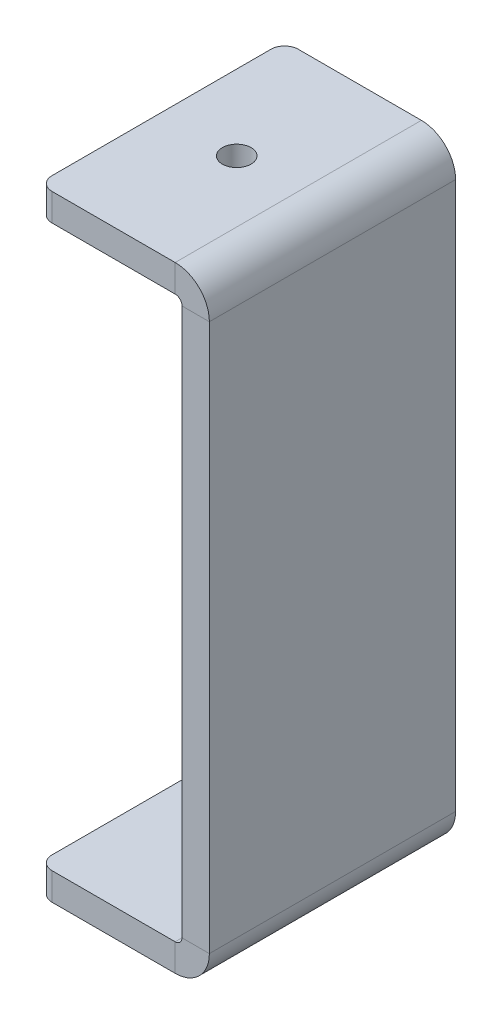
from build123d import *

# Parameters (mm, degrees)
BASE_FLANGE1_START    = -18
BASE_FLANGE1_DEPTH    = 36
FILLET1_R             = 2
M5_TAPPED_HOLE1_D     = 4.2
M5_TAPPED_HOLE1_DEPTH = 4


# Read off the part's stored shape, not the designer's step: Base-Flange1
with BuildPart() as part:
    # Base-Flange1 outline → Base-Flange1 (new body)
    with BuildSketch(Plane.XY.offset(BASE_FLANGE1_START)):
        with BuildLine():
            Line((-5, 45), (-25, 45))
            Line((-25, 45), (-25, 41))
            Line((-25, 41), (-5, 41))
            ThreePointArc((-5, 41), (-4.292893219, 40.707106781), (-4, 40))
            Line((-4, 40), (-4, -40))
            ThreePointArc((-4, -40), (-4.292893219, -40.707106781), (-5, -41))
            Line((-5, -41), (-25, -41))
            Line((-25, -41), (-25, -45))
            Line((-25, -45), (-5, -45))
            ThreePointArc((-5, -45), (-1.464466094, -43.535533906), (0, -40))
            Line((0, -40), (0, 40))
            ThreePointArc((0, 40), (-1.464466094, 43.535533906), (-5, 45))
        make_face()
    extrude(amount=BASE_FLANGE1_DEPTH)

    # Fillet1
    fillet1_edges = [part.edges().sort_by_distance(p)[0] for p in [
        (-25, -43, -18),
        (-25, 43, -18),
        (-25, -43, 18),
        (-25, 43, 18),
    ]]
    fillet(fillet1_edges, radius=FILLET1_R)

    # M5 Tapped Hole1
    with Locations(Plane(origin=(0, 45, 0), x_dir=(1, 0, 0), z_dir=(0, 1, 0))):
        with Locations((-14, 0)):
            m5_tapped_hole1 = Hole(M5_TAPPED_HOLE1_D / 2, depth=M5_TAPPED_HOLE1_DEPTH)

    # Mirror1: M5 Tapped Hole1 across plane
    add(m5_tapped_hole1.mirror(Plane.ZX), mode=Mode.SUBTRACT)


solid = part.part
